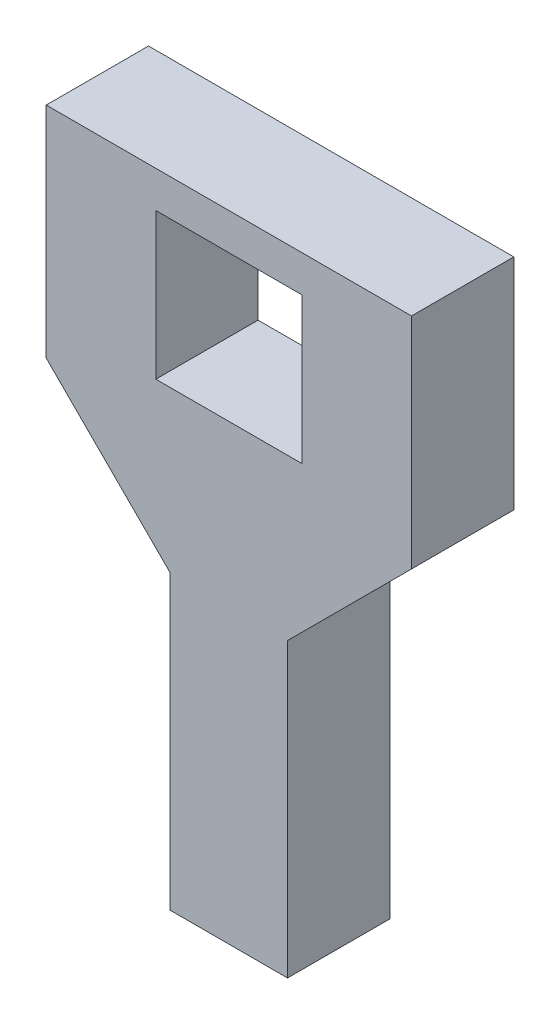
from build123d import *

# Parameters (mm, degrees)
CROQUIS1_W              = 10
CROQUIS1_H              = 10
SALIENTE_EXTRUIR1_DEPTH = 7


with BuildPart() as part:
    # Croquis1 → Saliente-Extruir1 (new body)
    with BuildSketch(Plane.XY):
        Polygon((12.5, 7.5), (-12.5, 7.5), (-12.5, -7.5), (-4.014718626, -15.985281374), (-4.014718626, -35.985281374), (4.014718626, -35.985281374), (4.014718626, -15.985281374), (12.5, -7.5), align=None)
        Rectangle(CROQUIS1_W, CROQUIS1_H, mode=Mode.SUBTRACT)
    extrude(amount=SALIENTE_EXTRUIR1_DEPTH)


solid = part.part
